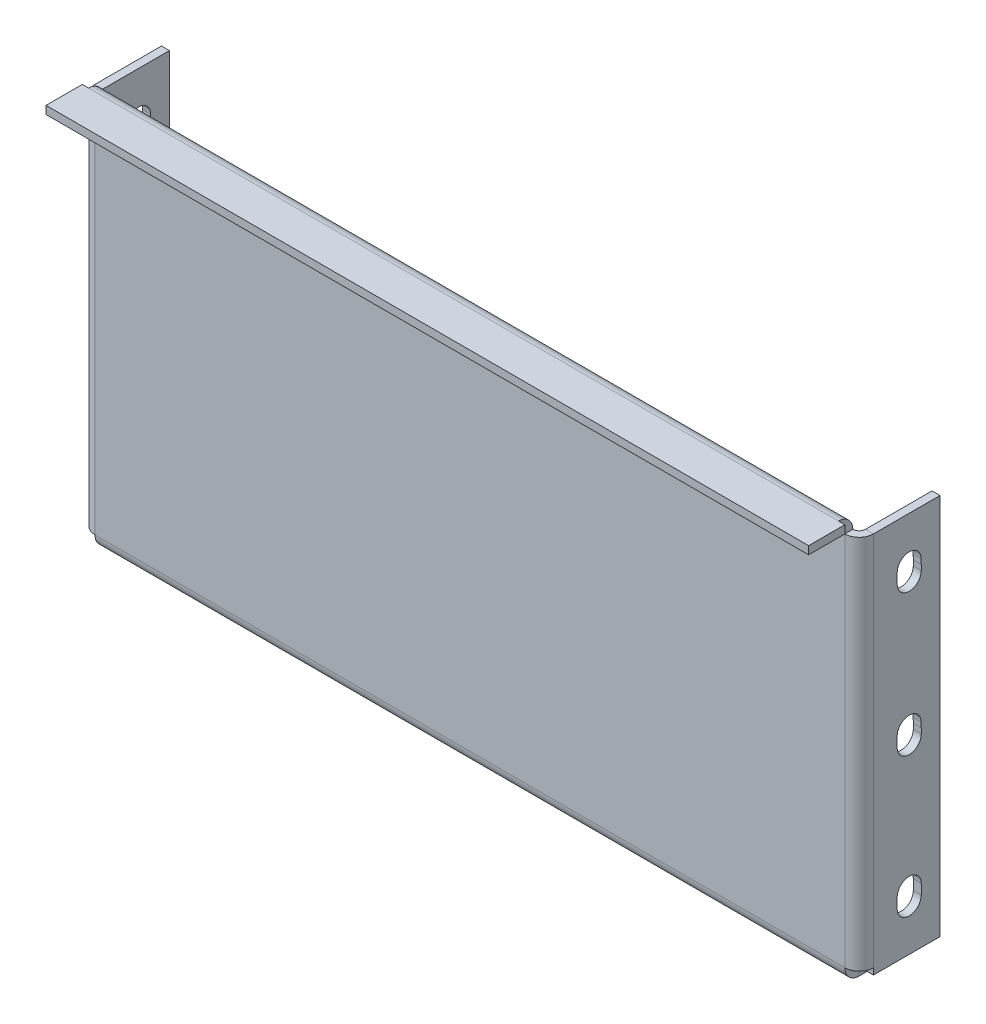
from build123d import *

# Parameters (mm, degrees)
SKETCH1_W                    = 191.7
SKETCH1_H                    = 99.64
BASE_FLANGE4_DEPTH           = 2
EDGE_FLANGE2_STRIP_W         = 11.175
EDGE_FLANGE2_STRIP_H         = 2
EDGE_FLANGE2_STRIP_CUT_DEPTH = 191.7
EDGE_FLANGE2_DEPTH           = 191.7
EDGE_FLANGE1_START           = -49.82
EDGE_FLANGE1_DEPTH           = 99.64
EDGE_FLANGE1_START_2         = 46.2325
EDGE_FLANGE1_2_DEPTH         = 3.5875
EDGE_FLANGE1_3_DEPTH         = 96.0525
EDGE_FLANGE3_START           = -97.85
EDGE_FLANGE3_DEPTH           = 195.7
EDGE_FLANGE3_2_DEPTH         = 3.5875
EDGE_FLANGE3_START_2         = 94.2625
EDGE_FLANGE3_3_DEPTH         = 3.5875
EDGE_FLANGE3_START_3         = -94.2625
EDGE_FLANGE3_4_DEPTH         = 188.525
CUT_EXTRUDE1_DEPTH           = 204.46180182
CUT_EXTRUDE2_DEPTH           = 3.175


# Read off the part's stored shape, not the designer's step: Edge-Flange1, Edge-Flange3
# Sheet-metal steps are written as plain solids
with BuildPart() as part:
    # Sketch1 → Base-Flange4 (new body)
    with BuildSketch(Plane.XY):
        Rectangle(SKETCH1_W, SKETCH1_H)
    extrude(amount=-BASE_FLANGE4_DEPTH)

    # Edge-Flange2 strip (across the edge) → Edge-Flange2 strip cut (cut)
    with BuildSketch(Plane(origin=(95.85, 49.82, 0), x_dir=(0, -1, 0), z_dir=(-1, 0, 0))):
        with Locations((-2, -1)):
            Rectangle(EDGE_FLANGE2_STRIP_W, EDGE_FLANGE2_STRIP_H)
    extrude(amount=EDGE_FLANGE2_STRIP_CUT_DEPTH, mode=Mode.SUBTRACT)

    # Edge-Flange2 section (across the edge) → Edge-Flange2 (add)
    with BuildSketch(Plane(origin=(95.85, 49.82, 0), x_dir=(0, -1, 0), z_dir=(-1, 0, 0))):
        with BuildLine():
            Line((0, 1.5875), (0, 10.7))
            Line((0, 10.7), (2, 10.7))
            Line((2, 10.7), (2, 1.5875))
            ThreePointArc((2, 1.5875), (2.464967985, 0.464967985), (3.5875, 0))
            Line((3.5875, 0), (3.5875, -2))
            ThreePointArc((3.5875, -2), (1.050754422, -0.949245578), (0, 1.5875))
        make_face()
    extrude(amount=EDGE_FLANGE2_DEPTH)

    # Edge-Flange1 outline → Edge-Flange1 (cut)
    with BuildSketch(Plane(origin=(0, 0, 0), x_dir=(1, 0, 0), z_dir=(0, 1, 0)).offset(EDGE_FLANGE1_START)):
        with BuildLine():
            Line((94.2625, -1.5875), (95.85, -1.5875))
            Line((95.85, -1.5875), (95.85, 0.370358411))
            ThreePointArc((95.85, 0.370358411), (95.07756466, 0.093816292), (94.2625, 0))
            Line((94.2625, 0), (94.2625, -1.5875))
        make_face()
        with BuildLine():
            Line((-95.85, 0.370358411), (-95.85, -1.5875))
            Line((-95.85, -1.5875), (-94.2625, -1.5875))
            Line((-94.2625, -1.5875), (-94.2625, 0))
            ThreePointArc((-94.2625, 0), (-95.07756466, 0.093816292), (-95.85, 0.370358411))
        make_face()
    extrude(amount=EDGE_FLANGE1_DEPTH, mode=Mode.SUBTRACT)

    # Edge-Flange1 2 outline → Edge-Flange1 2 (cut)
    with BuildSketch(Plane(origin=(0, 0, 0), x_dir=(1, 0, 0), z_dir=(0, 1, 0)).offset(EDGE_FLANGE1_START_2)):
        with BuildLine():
            Line((94.2625, 2), (94.2625, 0))
            ThreePointArc((94.2625, 0), (95.07756466, 0.093816292), (95.85, 0.370358411))
            ThreePointArc((95.85, 0.370358411), (97.30924519, 1.693430307), (97.85, 3.5875))
            Line((97.85, 3.5875), (97.85, 20.32))
            Line((97.85, 20.32), (95.85, 20.32))
            Line((95.85, 20.32), (95.85, 3.5875))
            ThreePointArc((95.85, 3.5875), (95.385032015, 2.464967985), (94.2625, 2))
        make_face()
        with BuildLine():
            ThreePointArc((-95.85, 0.370358411), (-95.07756466, 0.093816292), (-94.2625, 0))
            Line((-94.2625, 0), (-94.2625, 2))
            ThreePointArc((-94.2625, 2), (-95.385032015, 2.464967985), (-95.85, 3.5875))
            Line((-95.85, 3.5875), (-95.85, 20.32))
            Line((-95.85, 20.32), (-97.85, 20.32))
            Line((-97.85, 20.32), (-97.85, 3.5875))
            ThreePointArc((-97.85, 3.5875), (-97.30924519, 1.693430307), (-95.85, 0.370358411))
        make_face()
    extrude(amount=EDGE_FLANGE1_2_DEPTH, mode=Mode.SUBTRACT)

    # Edge-Flange1 3 outline → Edge-Flange1 3 (add)
    with BuildSketch(Plane(origin=(0, 0, 0), x_dir=(1, 0, 0), z_dir=(0, 1, 0)).offset(EDGE_FLANGE1_START)):
        with BuildLine():
            Line((94.2625, 2), (94.2625, 0))
            ThreePointArc((94.2625, 0), (95.07756466, 0.093816292), (95.85, 0.370358411))
            ThreePointArc((95.85, 0.370358411), (97.30924519, 1.693430307), (97.85, 3.5875))
            Line((97.85, 3.5875), (97.85, 20.32))
            Line((97.85, 20.32), (95.85, 20.32))
            Line((95.85, 20.32), (95.85, 3.5875))
            ThreePointArc((95.85, 3.5875), (95.385032015, 2.464967985), (94.2625, 2))
        make_face()
        with BuildLine():
            ThreePointArc((-95.85, 0.370358411), (-95.07756466, 0.093816292), (-94.2625, 0))
            Line((-94.2625, 0), (-94.2625, 2))
            ThreePointArc((-94.2625, 2), (-95.385032015, 2.464967985), (-95.85, 3.5875))
            Line((-95.85, 3.5875), (-95.85, 20.32))
            Line((-95.85, 20.32), (-97.85, 20.32))
            Line((-97.85, 20.32), (-97.85, 3.5875))
            ThreePointArc((-97.85, 3.5875), (-97.30924519, 1.693430307), (-95.85, 0.370358411))
        make_face()
    extrude(amount=EDGE_FLANGE1_3_DEPTH)

    # Edge-Flange3 outline → Edge-Flange3 (cut)
    with BuildSketch(Plane.YZ.offset(EDGE_FLANGE3_START)):
        with BuildLine():
            ThreePointArc((-48.2325, -2), (-49.355032015, -2.464967985), (-49.82, -3.5875))
            Line((-49.82, -3.5875), (-48.2325, -3.5875))
            Line((-48.2325, -3.5875), (-48.2325, -2))
        make_face()
        with BuildLine():
            ThreePointArc((-49.82, -0.370358411), (-49.04756466, -0.093816292), (-48.2325, 0))
            Line((-48.2325, 0), (-49.82, 0))
            Line((-49.82, 0), (-49.82, -0.370358411))
        make_face()
    extrude(amount=EDGE_FLANGE3_DEPTH, mode=Mode.SUBTRACT)

    # Edge-Flange3 2 outline → Edge-Flange3 2 (cut)
    with BuildSketch(Plane.YZ.offset(EDGE_FLANGE3_START)):
        with BuildLine():
            ThreePointArc((-49.82, -3.5875), (-49.355032015, -2.464967985), (-48.2325, -2))
            Line((-48.2325, -2), (-48.2325, 0))
            ThreePointArc((-48.2325, 0), (-49.04756466, -0.093816292), (-49.82, -0.370358411))
            Line((-49.82, -0.370358411), (-49.82, -3.5875))
        make_face()
    extrude(amount=EDGE_FLANGE3_2_DEPTH, mode=Mode.SUBTRACT)

    # Edge-Flange3 3 outline → Edge-Flange3 3 (cut)
    with BuildSketch(Plane.YZ.offset(EDGE_FLANGE3_START_2)):
        with BuildLine():
            ThreePointArc((-49.82, -3.5875), (-49.355032015, -2.464967985), (-48.2325, -2))
            Line((-48.2325, -2), (-48.2325, 0))
            ThreePointArc((-48.2325, 0), (-49.04756466, -0.093816292), (-49.82, -0.370358411))
            Line((-49.82, -0.370358411), (-49.82, -3.5875))
        make_face()
    extrude(amount=EDGE_FLANGE3_3_DEPTH, mode=Mode.SUBTRACT)

    # Edge-Flange3 4 outline → Edge-Flange3 4 (add)
    with BuildSketch(Plane.YZ.offset(EDGE_FLANGE3_START_3)):
        with BuildLine():
            Line((-48.2325, -2), (-49.82, -2))
            Line((-49.82, -2), (-49.82, -0.370358411))
            ThreePointArc((-49.82, -0.370358411), (-51.27924519, -1.693430307), (-51.82, -3.5875))
            Line((-51.82, -3.5875), (-51.82, -20.32))
            Line((-51.82, -20.32), (-49.82, -20.32))
            Line((-49.82, -20.32), (-49.82, -3.5875))
            ThreePointArc((-49.82, -3.5875), (-49.355032015, -2.464967985), (-48.2325, -2))
        make_face()
    extrude(amount=EDGE_FLANGE3_4_DEPTH)

    # Sketch42 → Cut-Extrude1 (cut, through all)
    with BuildSketch(Plane.ZY.offset(97.85)):
        with BuildLine():
            ThreePointArc((-9.566529979, 34.815400328), (-12.586590694, 37.822400713), (-15.593591079, 34.802339997))
            Line((-15.593591079, 34.802339997), (-15.61375, 33.5325))
            Line((-15.61375, 33.5325), (-15.61375, 32.2625))
            ThreePointArc((-15.61375, 32.2625), (-12.58875, 29.2375), (-9.56375, 32.2625))
            Line((-9.56375, 32.2625), (-9.56375, 33.5325))
            Line((-9.56375, 33.5325), (-9.566529979, 34.815400328))
        make_face()
        with BuildLine():
            Line((-15.61375, -35.85), (-15.61375, -38.39))
            ThreePointArc((-15.61375, -38.39), (-12.58875, -41.415), (-9.56375, -38.39))
            Line((-9.56375, -38.39), (-9.56375, -35.85))
            ThreePointArc((-9.56375, -35.85), (-12.58875, -32.825), (-15.61375, -35.85))
        make_face()
        with BuildLine():
            Line((-9.56375, -3.2975), (-9.56375, -2.0275))
            Line((-9.56375, -2.0275), (-9.566529979, -0.744599672))
            ThreePointArc((-9.566529979, -0.744599672), (-12.586590694, 2.262400713), (-15.593591079, -0.757660003))
            Line((-15.593591079, -0.757660003), (-15.61375, -2.0275))
            Line((-15.61375, -2.0275), (-15.61375, -3.2975))
            ThreePointArc((-15.61375, -3.2975), (-12.58875, -6.3225), (-9.56375, -3.2975))
        make_face()
    extrude(amount=-CUT_EXTRUDE1_DEPTH, mode=Mode.SUBTRACT)

    # Sketch43 → Cut-Extrude2 (cut)
    with BuildSketch(Plane.XZ.offset(51.82)):
        with BuildLine():
            Line((-23.1425, -8.92875), (-25.6825, -8.92875))
            ThreePointArc((-25.6825, -8.92875), (-28.448425456, -12.005254825), (-25.572047177, -14.97875))
            Line((-25.572047177, -14.97875), (-23.1425, -14.97875))
            ThreePointArc((-23.1425, -14.97875), (-20.1175, -11.95375), (-23.1425, -8.92875))
        make_face()
        with BuildLine():
            Line((34.0075, -8.92875), (31.4675, -8.92875))
            ThreePointArc((31.4675, -8.92875), (28.701574544, -12.005254825), (31.577952823, -14.97875))
            Line((31.577952823, -14.97875), (34.0075, -14.97875))
            ThreePointArc((34.0075, -14.97875), (37.0325, -11.95375), (34.0075, -8.92875))
        make_face()
        with BuildLine():
            ThreePointArc((-80.2925, -14.97875), (-77.2675, -11.95375), (-80.2925, -8.92875))
            Line((-80.2925, -8.92875), (-82.8325, -8.92875))
            ThreePointArc((-82.8325, -8.92875), (-85.598425456, -12.005254825), (-82.722047177, -14.97875))
            Line((-82.722047177, -14.97875), (-80.2925, -14.97875))
        make_face()
        with BuildLine():
            Line((82.2675, -8.92875), (79.7275, -8.92875))
            ThreePointArc((79.7275, -8.92875), (76.961574544, -12.005254825), (79.837952823, -14.97875))
            Line((79.837952823, -14.97875), (82.2675, -14.97875))
            ThreePointArc((82.2675, -14.97875), (85.2925, -11.95375), (82.2675, -8.92875))
        make_face()
    extrude(amount=-CUT_EXTRUDE2_DEPTH, mode=Mode.SUBTRACT)


solid = part.part
